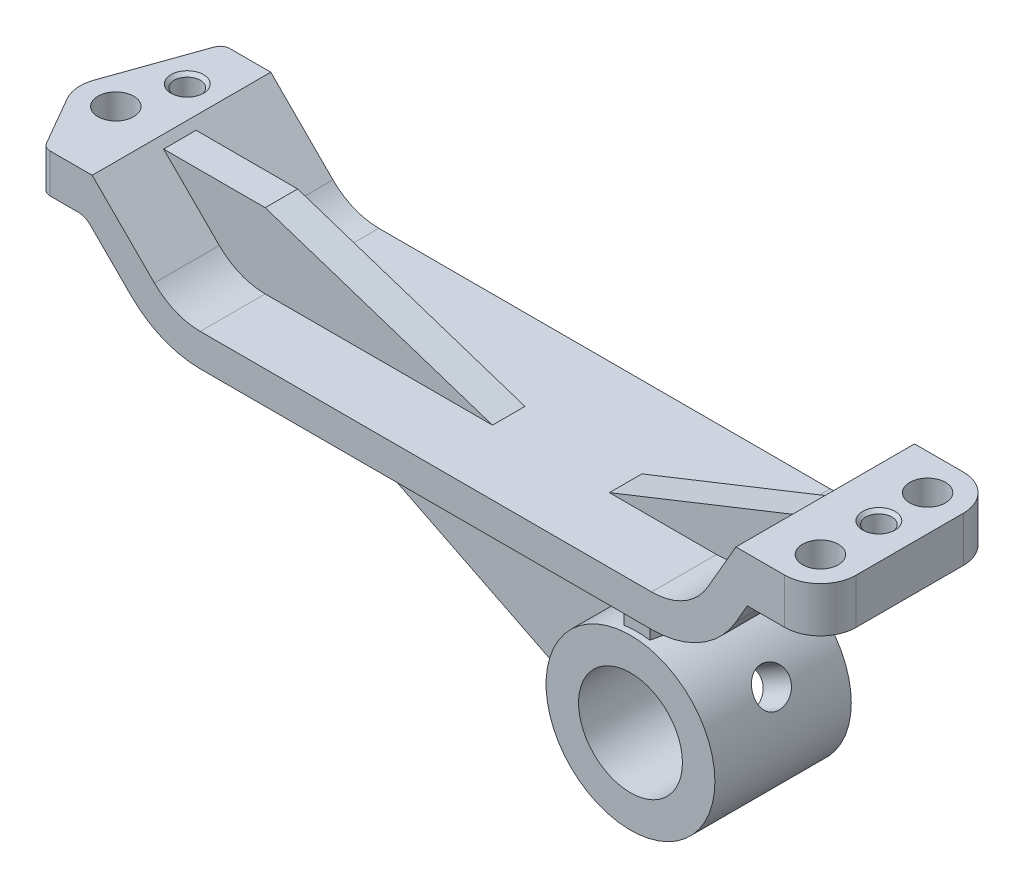
from build123d import *

# Parameters (mm, degrees)
SKETCH_1_R               = 26
EXTRUDE_1_DEPTH          = 21
SKETCH_2_R               = 16
CUT_EXTRUDE_1_DEPTH      = 56.821142948
CUT_EXTRUDE_2_REACH      = 67.695
CUT_EXTRUDE_2_END_RADIUS = 16
SKETCH_3_R               = 5.5
EXTRUDE_2_DEPTH          = 27.5
CUT_EXTRUDE_4_DEPTH      = 212.291599501
CUT_EXTRUDE_4_DEPTH_BACK = 212.291599501
CUT_EXTRUDE_START        = -13.947107552
CUT_EXTRUDE_6_DEPTH      = 13.947107552
SKETCH_7_R               = 5.5
CUT_EXTRUDE_7_DEPTH      = 212.291599501
SKETCH_8_R               = 5.5
CUT_EXTRUDE_8_DEPTH      = 212.291599501
RIB_1_DEPTH              = 10
FILLET_1_R               = 3
RIB_8_REACH              = 202.879
SKETCH_16_WALL_W         = 465.989842276
SKETCH_16_WALL_H         = 10
EXTRUDE_3_DEPTH          = 5
EXTRUDE_4_REACH          = 199.454
EXTRUDE_4_END_RADIUS     = 26


# Read off the part's stored shape, not the designer's step: 切除-拉伸6, 筋1
with BuildPart() as part:
    # 草图1 → 凸台-拉伸1 (new, symmetric)
    with BuildSketch(Plane.XY):
        with Locations(Location((0, 0, 0), (0, 0, 180))):
            Circle(SKETCH_1_R)
    extrude(amount=EXTRUDE_1_DEPTH, both=True)

    # 草图2 → 切除-拉伸1 (cut, through all)
    with BuildSketch(Plane.XY.offset(21)):
        Circle(SKETCH_2_R)
    extrude(amount=-CUT_EXTRUDE_1_DEPTH, mode=Mode.SUBTRACT)

    # 切除-拉伸2: up to this cylinder (the profile starts outside it)
    cut_extrude_2_end = Plane(origin=(0, 0, 0), z_dir=(0, 0, 1)) * Cylinder(CUT_EXTRUDE_2_END_RADIUS, 168.39, mode=Mode.PRIVATE)
    # 草图3 → 切除-拉伸2 (cut, up to the surface)
    with BuildSketch(Plane(origin=(22.516660498, 13, 0), x_dir=(0, 0, -1), z_dir=(0.8660254037844398, 0.499999999999998, 0)), mode=Mode.PRIVATE) as cut_extrude_2_sk1:
        with Locations(Location((0, 0, 0), (0, 0, 90))):
            Circle(SKETCH_3_R)
    cut_extrude_2_tool1 = extrude(cut_extrude_2_sk1.sketch, amount=-CUT_EXTRUDE_2_REACH, mode=Mode.PRIVATE) - cut_extrude_2_end
    add(cut_extrude_2_tool1.solids().sort_by_distance((22.51666, 13, 0))[0], mode=Mode.SUBTRACT)



with BuildPart() as body_2:
    # 草图4 → 凸台-拉伸2 (new, symmetric)
    with BuildSketch(Plane.XY):
        with BuildLine():
            Line((-185, 60.3), (-163.497474683, 60.3))
            ThreePointArc((-163.497474683, 60.3), (-161.584057521, 59.919397663), (-159.961940777, 58.835533906))
            Line((-159.961940777, 58.835533906), (-147.213203436, 46.086796564))
            ThreePointArc((-147.213203436, 46.086796564), (-137.480502971, 39.583614025), (-126, 37.3))
            Line((-126, 37.3), (13, 37.3))
            ThreePointArc((13, 37.3), (28, 41.319237886), (38.980762114, 52.3))
            Line((38.980762114, 52.3), (42.475401198, 58.352892448))
            Line((42.475401198, 58.352892448), (65, 58.352892448))
            Line((65, 58.352892448), (65, 72.3))
            Line((65, 72.3), (38.980762114, 72.3))
            Line((38.980762114, 72.3), (30.320508076, 57.3))
            ThreePointArc((30.320508076, 57.3), (23, 49.979491924), (13, 47.3))
            Line((13, 47.3), (-126, 47.3))
            ThreePointArc((-126, 47.3), (-133.653668647, 48.82240935), (-140.142135624, 53.157864376))
            Line((-140.142135624, 53.157864376), (-159.284271247, 72.3))
            Line((-159.284271247, 72.3), (-185, 72.3))
            Line((-185, 72.3), (-185, 60.3))
        make_face()
    extrude(amount=EXTRUDE_2_DEPTH, both=True)

    # 草图5 → 切除-拉伸4 (cut, two sides: drawn at the far end of the back side and taken through both)
    with BuildSketch(Plane(origin=(0, 72.3, 0), x_dir=(1, 0, 0), z_dir=(0, 1, 0)).offset(-CUT_EXTRUDE_4_DEPTH_BACK)):
        with BuildLine():
            Line((-7.168790364, 499.369918589), (-174, 27.5))
            Line((-174, 27.5), (-184.370899457, -1.833333333))
            ThreePointArc((-184.370899457, -1.833333333), (-184.953601074, -6.509268805), (-183.526279442, -11))
            Line((-183.526279442, -11), (-174, -27.5))
            Line((-174, -27.5), (76.246814454, -460.940197067))
            Line((76.246814454, -460.940197067), (-920.985347946, -547.562968831))
            Line((-920.985347946, -547.562968831), (-1004.400952764, 412.747146826))
            Line((-1004.400952764, 412.747146826), (-7.168790364, 499.369918589))
        make_face()
    extrude(amount=CUT_EXTRUDE_4_DEPTH + CUT_EXTRUDE_4_DEPTH_BACK, mode=Mode.SUBTRACT)

    # 切除-拉伸6 outline → 切除-拉伸6 (cut)
    with BuildSketch(Plane(origin=(0, 72.3, 0), x_dir=(1, 0, 0), z_dir=(0, 1, 0)).offset(CUT_EXTRUDE_START)):
        with BuildLine():
            Line((65, -27.5), (65, -16.5))
            ThreePointArc((65, -16.5), (61.778174593, -24.278174593), (54, -27.5))
            Line((54, -27.5), (65, -27.5))
        make_face()
        with BuildLine():
            ThreePointArc((54, 27.5), (61.778174593, 24.278174593), (65, 16.5))
            Line((65, 16.5), (65, 27.5))
            Line((65, 27.5), (54, 27.5))
        make_face()
    extrude(amount=CUT_EXTRUDE_6_DEPTH, mode=Mode.SUBTRACT)

    # 草图7 → 切除-拉伸7 (cut, through all)
    with BuildSketch(Plane(origin=(0, 72.3, 0), x_dir=(1, 0, 0), z_dir=(0, 1, 0))):
        with Locations(Location((54, 16.5, 0), (0, 0, 270))):
            Circle(SKETCH_7_R)
    cut_extrude_7 = extrude(amount=-CUT_EXTRUDE_7_DEPTH, mode=Mode.SUBTRACT)

    # 镜向1: 切除-拉伸7 across plane
    add(cut_extrude_7.mirror(Plane.XY), mode=Mode.SUBTRACT)

    # 草图8 → 切除-拉伸8 (cut, through all)
    with BuildSketch(Plane(origin=(0, 72.3, 0), x_dir=(1, 0, 0), z_dir=(0, 1, 0))):
        with Locations(Location((-174, -5.5, 0), (0, 0, 270))):
            Circle(SKETCH_8_R)
    extrude(amount=-CUT_EXTRUDE_8_DEPTH, mode=Mode.SUBTRACT)

    # 草图10 → Ø8.0mm 暗销孔1 (revolve, cut)
    with BuildSketch(Plane(origin=(54, 72.3, -1.5), x_dir=(0, 0, 1), z_dir=(1, 0, 0))):
        Polygon((0, 0), (0, 13.948107552), (4, 13.948107552), (4, 1), (5, 0), align=None)
    revolve(axis=Axis((54, 78.65, -1.5), (0, -1, 0)), mode=Mode.SUBTRACT)

    # 草图12 → Ø8.0mm 暗销孔2 (revolve, cut)
    with BuildSketch(Plane(origin=(-169, 72.3, -11.5), x_dir=(0, 0, 1), z_dir=(1, 0, 0))):
        Polygon((0, 0), (0, 12.001), (4, 12.001), (4, 1), (5, 0), align=None)
    revolve(axis=Axis((-169, 78.65, -11.5), (0, -1, 0)), mode=Mode.SUBTRACT)

    # 筋1 outline → 筋1 (add)
    with BuildSketch(Plane.XY.offset(-2.5)):
        with BuildLine():
            Line((-56, 47.3), (-126, 70.3))
            Line((-126, 70.3), (-157.284271247, 70.3))
            Line((-157.284271247, 70.3), (-140.142135624, 53.157864376))
            ThreePointArc((-140.142135624, 53.157864376), (-133.653668647, 48.82240935), (-126, 47.3))
            Line((-126, 47.3), (-56, 47.3))
        make_face()
    extrude(amount=RIB_1_DEPTH)

    # 圆角1
    fillet_1_edges = [body_2.edges().sort_by_distance(p)[0] for p in [
        (-174, 66.3, -27.5),
        (-174, 66.3, 27.5),
    ]]
    fillet(fillet_1_edges, radius=FILLET_1_R)

    # 草图16 wall → 筋8 (add, up to next)
    with BuildSketch(Plane(origin=(8.913030787, 58.8, -2.5), x_dir=(0.929197613161, 0.369583273019, 0), z_dir=(-0.369583273019, 0.929197613161, 0)), mode=Mode.PRIVATE) as rib_8_sk1:
        with Locations((0, -5)):
            Rectangle(SKETCH_16_WALL_W, SKETCH_16_WALL_H)
    rib_8_tool1 = extrude(rib_8_sk1.sketch, amount=-RIB_8_REACH, mode=Mode.PRIVATE) - body_2.part
    add(rib_8_tool1.solids().sort_by_distance((8.913030787, 58.8, -2.5))[0])


with BuildPart() as part_1:
    add(part.part)

    add(body_2.part)  # 凸台-拉伸3 merges body 2
    # 草图17 → 凸台-拉伸3 (add, symmetric)
    with BuildSketch(Plane.XY):
        with BuildLine():
            Line((-11.614576615, -23.261590875), (-137.480502971, 39.583614025))
            ThreePointArc((-137.480502971, 39.583614025), (-131.85270966, 37.876441588), (-126, 37.3))
            Line((-126, 37.3), (13, 37.3))
            ThreePointArc((13, 37.3), (21.130139995, 38.422658993), (28.651788339, 41.706611756))
            Line((28.651788339, 41.706611756), (10, 30.3))
            ThreePointArc((10, 30.3), (8.254139309, 26.922225109), (10.440740808, 23.811571375))
            ThreePointArc((10.440740808, 23.811571375), (-23.543897802, 11.031086814), (-11.614576615, -23.261590875))
        make_face()
    extrude(amount=EXTRUDE_3_DEPTH, both=True)

    # 凸台-拉伸4: up to this cylinder (the profile starts outside it)
    extrude_4_end = Plane(origin=(0, 0, 0), z_dir=(0, 0, -1)) * Cylinder(EXTRUDE_4_END_RADIUS, 451.908, mode=Mode.PRIVATE)
    # 草图19 → 凸台-拉伸4 (add, up to the surface)
    with BuildSketch(Plane.XZ.offset(-37.3), mode=Mode.PRIVATE) as extrude_4_sk1:
        Polygon((-4, -19), (4, -19), (7.350212633, 0), (4, 19), (-4, 19), (-7.350212633, 0), align=None)
    extrude_4_tool1 = extrude(extrude_4_sk1.sketch, amount=EXTRUDE_4_REACH, mode=Mode.PRIVATE) - extrude_4_end
    add(extrude_4_tool1.solids().sort_by_distance((0, 37.3, 0))[0])


solid = part_1.part
